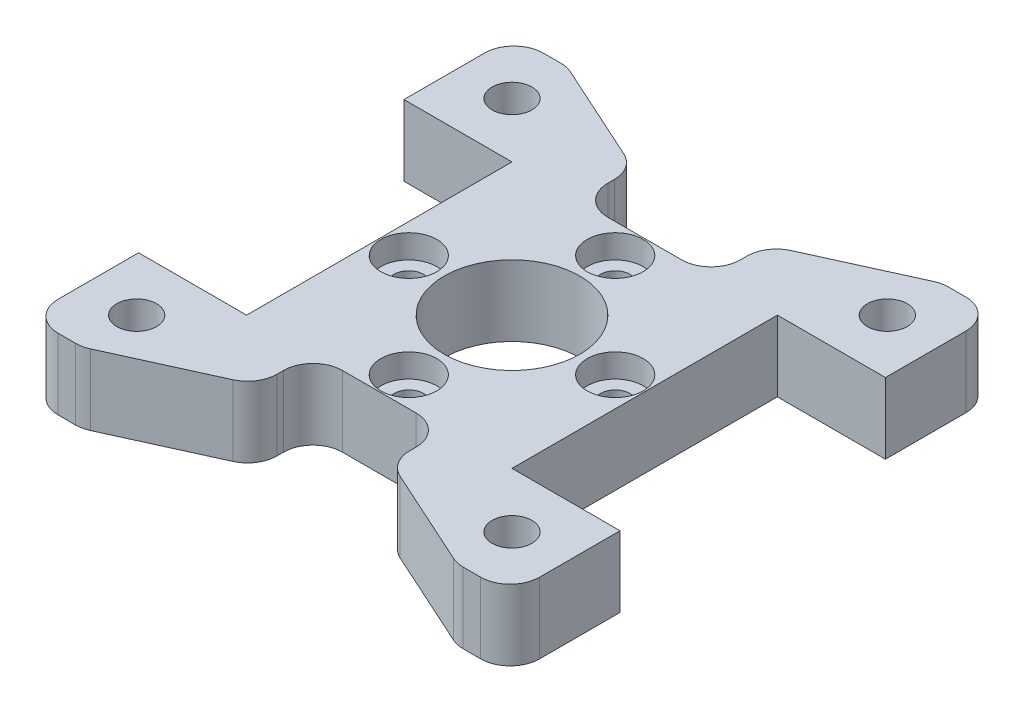
from build123d import *

# Parameters (mm, degrees)
BOSS_EXTRUDE1_DEPTH = 12
SKETCH2_R           = 11.5
SKETCH2_R_2         = 3.375
SKETCH2_R_3         = 2.5
CUT_EXTRUDE1_DEPTH  = 60.183951041
SKETCH3_R           = 7.5
CUT_EXTRUDE2_DEPTH  = 4.33
FILLET3_R           = 5
SKETCH4_R           = 4.75
CUT_EXTRUDE3_DEPTH  = 4


with BuildPart() as part:
    # Sketch1 → Boss-Extrude1 (new body)
    with BuildSketch(Plane(origin=(0, 0, 0), x_dir=(1, 0, 0), z_dir=(0, 1, 0))):
        Polygon((-22.5, 22.5), (-22.5, -22.5), (-40.819805153, -22.5), (-40.819805153, -41.139805153), (-31.788474194, -41.139805153), (-11.25, -31.819805153), (-11.25, -22.5), (11.25, -22.5), (11.25, -31.819805153), (31.788474194, -41.139805153), (40.819805153, -41.139805153), (40.819805153, -22.5), (22.5, -22.5), (22.5, 22.5), (40.819805153, 22.5), (40.819805153, 41.139805153), (31.788474194, 41.139805153), (11.25, 31.819805153), (11.25, 22.5), (-11.25, 22.5), (-11.25, 31.819805153), (-31.788474194, 41.139805153), (-40.819805153, 41.139805153), (-40.819805153, 22.5), align=None)
    extrude(amount=BOSS_EXTRUDE1_DEPTH)

    # Sketch2 → Cut-Extrude1 (cut, through all)
    with BuildSketch(Plane(origin=(0, 12, 0), x_dir=(1, 0, 0), z_dir=(0, 1, 0))):
        Circle(SKETCH2_R)
        with Locations((-31.819805153, 31.819805153)):
            Circle(SKETCH2_R_2)
        with Locations((31.819805153, 31.819805153)):
            Circle(SKETCH2_R_2)
        with Locations((31.819805153, -31.819805153)):
            Circle(SKETCH2_R_2)
        with Locations((-31.819805153, -31.819805153)):
            Circle(SKETCH2_R_2)
        with Locations((0, 17.5)):
            Circle(SKETCH2_R_3)
        with Locations((17.5, 0)):
            Circle(SKETCH2_R_3)
        with Locations((0, -17.5)):
            Circle(SKETCH2_R_3)
        with Locations((-17.5, 0)):
            Circle(SKETCH2_R_3)
    extrude(amount=-CUT_EXTRUDE1_DEPTH, mode=Mode.SUBTRACT)

    # Sketch3 → Cut-Extrude2 (cut)
    with BuildSketch(Plane.XZ):
        with Locations((31.819805153, -31.819805153)):
            Circle(SKETCH3_R)
        with Locations((-31.819805153, -31.819805153)):
            Circle(SKETCH3_R)
        with Locations((-31.819805153, 31.819805153)):
            Circle(SKETCH3_R)
        with Locations((31.819805153, 31.819805153)):
            Circle(SKETCH3_R)
    extrude(amount=-CUT_EXTRUDE2_DEPTH, mode=Mode.SUBTRACT)

    # Fillet3
    fillet3_edges = [part.edges().sort_by_distance(p)[0] for p in [
        (-40.819805153, 6, 41.139805153),
        (-31.788474194, 6, 41.139805153),
        (-11.25, 6, 31.819805153),
        (11.25, 6, 22.5),
        (-11.25, 6, 22.5),
        (40.819805153, 6, 41.139805153),
        (31.788474194, 6, 41.139805153),
        (11.25, 6, 31.819805153),
        (-40.819805153, 6, -41.139805153),
        (-31.788474194, 6, -41.139805153),
        (-11.25, 6, -31.819805153),
        (-11.25, 6, -22.5),
        (11.25, 6, -22.5),
        (11.25, 6, -31.819805153),
        (31.788474194, 6, -41.139805153),
        (40.819805153, 6, -41.139805153),
    ]]
    fillet(fillet3_edges, radius=FILLET3_R)

    # Sketch4 → Cut-Extrude3 (cut)
    with BuildSketch(Plane(origin=(0, 12, 0), x_dir=(1, 0, 0), z_dir=(0, 1, 0))):
        with Locations((0, 17.5)):
            Circle(SKETCH4_R)
        with Locations((17.5, 0)):
            Circle(SKETCH4_R)
        with Locations((0, -17.5)):
            Circle(SKETCH4_R)
        with Locations((-17.5, 0)):
            Circle(SKETCH4_R)
    extrude(amount=-CUT_EXTRUDE3_DEPTH, mode=Mode.SUBTRACT)


solid = part.part
